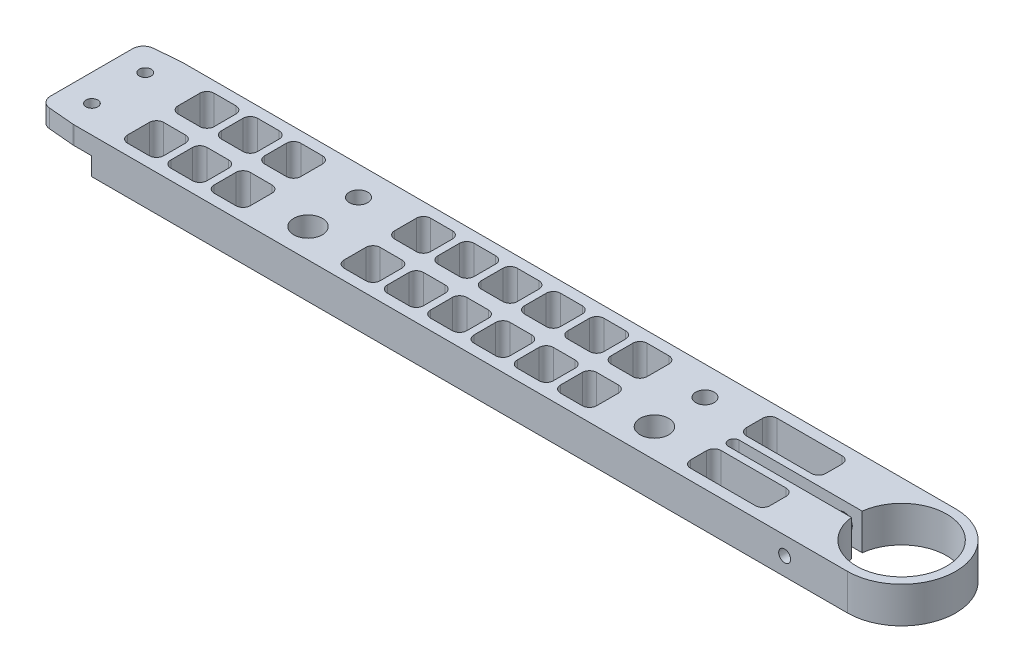
from build123d import *

# Parameters (mm, degrees)
EXTRUDE_1_DEPTH             = 10
SKETCH_4_W                  = 15
SKETCH_4_H                  = 30
CUT_EXTRUDE_2_DEPTH         = 5
FILLET_1_R                  = 3
CUT_EXTRUDE_3_DEPTH         = 243.074368738
SKETCH_6_W                  = 23.844659042
SKETCH_6_H                  = 25.610930083
SKETCH_6_W_2                = 24.286226803
EXTRUDE_2_DEPTH             = 10
HOLE_WIZARD_1_4_201_D       = 5.1054
HOLE_WIZARD_3_8_161_D       = 7.9375
SKETCH_12_R                 = 12.5
CUT_EXTRUDE_4_DEPTH         = 243.074368738
SKETCH_13_W                 = 12.089662748
SKETCH_13_H                 = 26.414389197
EXTRUDE_3_DEPTH             = 10
CUT_EXTRUDE_5_DEPTH         = 10
SKETCH_16_W                 = 1.65
SKETCH_16_H                 = 13.5
HOLE_WIZARD_M41_D           = 4.5
HOLE_WIZARD_M41_DEPTH       = 13.5
HOLE_WIZARD_M41_CBORE_D     = 8
HOLE_WIZARD_M41_CBORE_DEPTH = 4
M4X0_73_D                   = 3.3
EXTRUDE_5_DEPTH             = 10
CUT_EXTRUDE_6_DEPTH         = 242.578662137


with BuildPart() as part:
    # Эскиз1 → Бобышка-Вытянуть1 (new body)
    with BuildSketch(Plane(origin=(0, 0, 0), x_dir=(1, 0, 0), z_dir=(0, 1, 0))):
        Polygon((15, 0), (240, 0), (240, 30), (15, 30), (10, 30), (0, 29.125113365), (0, 0.874886635), (10, 0), align=None)
    extrude(amount=EXTRUDE_1_DEPTH)

    # Эскиз4 → Вырез-Вытянуть2 (cut)
    with BuildSketch(Plane.XZ):
        with Locations((7.5, -15)):
            Rectangle(SKETCH_4_W, SKETCH_4_H)
    extrude(amount=-CUT_EXTRUDE_2_DEPTH, mode=Mode.SUBTRACT)

    # Скругление1
    # the kernel refuses this fillet: 3 mm, written as the material it takes off along each edge
    with BuildSketch(Plane(origin=(10, 4.672542928, 0), x_dir=(1, 0, 0), z_dir=(0, 1, 0))) as fillet_1_piece_1:
        with BuildLine():
            CenterArc((FILLET_1_R * 0.0436609429085, FILLET_1_R), FILLET_1_R, 265, 5)
            Line((-FILLET_1_R * 0.0434947998391, FILLET_1_R * 0.00380530190825), (0, 0))
            Line((0, 0), (FILLET_1_R * 0.0436609429085, 0))
        make_face()
    extrude(amount=5.654914144, mode=Mode.SUBTRACT)
    with BuildSketch(Plane(origin=(0, -1.872483805, -0.874886635), x_dir=(0.9961946980917453, 0, 0.08715574274766123), z_dir=(0, 1, 0))) as fillet_1_piece_2:
        with BuildLine():
            CenterArc((FILLET_1_R * 0.916331174017, FILLET_1_R), FILLET_1_R, 185, 85)
            Line((-FILLET_1_R * 0.0798635240743, FILLET_1_R * 0.912844257252), (0, 0))
            Line((0, 0), (FILLET_1_R * 0.916331174017, 0))
        make_face()
    extrude(amount=18.74496761, mode=Mode.SUBTRACT)
    with BuildSketch(Plane(origin=(0, -1.872483805, -29.125113365), x_dir=(0.9961946980917452, 0, -0.08715574274766204), z_dir=(0, 1, 0))) as fillet_1_piece_3:
        with BuildLine():
            CenterArc((FILLET_1_R * 0.916331174017, -FILLET_1_R), FILLET_1_R, 90, 85)
            Line((-FILLET_1_R * 0.0798635240743, -FILLET_1_R * 0.912844257252), (0, 0))
            Line((0, 0), (FILLET_1_R * 0.916331174017, 0))
        make_face()
    extrude(amount=18.74496761, mode=Mode.SUBTRACT)
    with BuildSketch(Plane(origin=(10, 4.672542928, -30), x_dir=(1, 0, 0), z_dir=(0, 1, 0))) as fillet_1_piece_4:
        with BuildLine():
            CenterArc((FILLET_1_R * 0.0436609429085, -FILLET_1_R), FILLET_1_R, 90, 5)
            Line((-FILLET_1_R * 0.0434947998391, -FILLET_1_R * 0.00380530190825), (0, 0))
            Line((0, 0), (FILLET_1_R * 0.0436609429085, 0))
        make_face()
    extrude(amount=5.654914144, mode=Mode.SUBTRACT)

    # Эскиз5 → Вырез-Вытянуть3 (cut, through all)
    with BuildSketch(Plane.XZ):
        with BuildLine():
            Line((22, -17), (28, -17))
            ThreePointArc((28, -17), (29.414213562, -17.585786438), (30, -19))
            Line((30, -19), (30, -25))
            ThreePointArc((30, -25), (29.414213562, -26.414213562), (28, -27))
            Line((28, -27), (22, -27))
            ThreePointArc((22, -27), (20.585786438, -26.414213562), (20, -25))
            Line((20, -25), (20, -19))
            ThreePointArc((20, -19), (20.585786438, -17.585786438), (22, -17))
        make_face()
        with BuildLine():
            Line((34, -17), (40, -17))
            ThreePointArc((40, -17), (41.414213562, -17.585786438), (42, -19))
            Line((42, -19), (42, -25))
            ThreePointArc((42, -25), (41.414213562, -26.414213562), (40, -27))
            Line((40, -27), (34, -27))
            ThreePointArc((34, -27), (32.585786438, -26.414213562), (32, -25))
            Line((32, -25), (32, -19))
            ThreePointArc((32, -19), (32.585786438, -17.585786438), (34, -17))
        make_face()
        with BuildLine():
            Line((46, -17), (52, -17))
            ThreePointArc((52, -17), (53.414213562, -17.585786438), (54, -19))
            Line((54, -19), (54, -25))
            ThreePointArc((54, -25), (53.414213562, -26.414213562), (52, -27))
            Line((52, -27), (46, -27))
            ThreePointArc((46, -27), (44.585786438, -26.414213562), (44, -25))
            Line((44, -25), (44, -19))
            ThreePointArc((44, -19), (44.585786438, -17.585786438), (46, -17))
        make_face()
        with BuildLine():
            Line((58, -17), (64, -17))
            ThreePointArc((64, -17), (65.414213562, -17.585786438), (66, -19))
            Line((66, -19), (66, -25))
            ThreePointArc((66, -25), (65.414213562, -26.414213562), (64, -27))
            Line((64, -27), (58, -27))
            ThreePointArc((58, -27), (56.585786438, -26.414213562), (56, -25))
            Line((56, -25), (56, -19))
            ThreePointArc((56, -19), (56.585786438, -17.585786438), (58, -17))
        make_face()
        with BuildLine():
            Line((70, -17), (76, -17))
            ThreePointArc((76, -17), (77.414213562, -17.585786438), (78, -19))
            Line((78, -19), (78, -25))
            ThreePointArc((78, -25), (77.414213562, -26.414213562), (76, -27))
            Line((76, -27), (70, -27))
            ThreePointArc((70, -27), (68.585786438, -26.414213562), (68, -25))
            Line((68, -25), (68, -19))
            ThreePointArc((68, -19), (68.585786438, -17.585786438), (70, -17))
        make_face()
        with BuildLine():
            Line((82, -17), (88, -17))
            ThreePointArc((88, -17), (89.414213562, -17.585786438), (90, -19))
            Line((90, -19), (90, -25))
            ThreePointArc((90, -25), (89.414213562, -26.414213562), (88, -27))
            Line((88, -27), (82, -27))
            ThreePointArc((82, -27), (80.585786438, -26.414213562), (80, -25))
            Line((80, -25), (80, -19))
            ThreePointArc((80, -19), (80.585786438, -17.585786438), (82, -17))
        make_face()
        with BuildLine():
            Line((94, -17), (100, -17))
            ThreePointArc((100, -17), (101.414213562, -17.585786438), (102, -19))
            Line((102, -19), (102, -25))
            ThreePointArc((102, -25), (101.414213562, -26.414213562), (100, -27))
            Line((100, -27), (94, -27))
            ThreePointArc((94, -27), (92.585786438, -26.414213562), (92, -25))
            Line((92, -25), (92, -19))
            ThreePointArc((92, -19), (92.585786438, -17.585786438), (94, -17))
        make_face()
        with BuildLine():
            Line((106, -17), (112, -17))
            ThreePointArc((112, -17), (113.414213562, -17.585786438), (114, -19))
            Line((114, -19), (114, -25))
            ThreePointArc((114, -25), (113.414213562, -26.414213562), (112, -27))
            Line((112, -27), (106, -27))
            ThreePointArc((106, -27), (104.585786438, -26.414213562), (104, -25))
            Line((104, -25), (104, -19))
            ThreePointArc((104, -19), (104.585786438, -17.585786438), (106, -17))
        make_face()
        with BuildLine():
            Line((118, -17), (124, -17))
            ThreePointArc((124, -17), (125.414213562, -17.585786438), (126, -19))
            Line((126, -19), (126, -25))
            ThreePointArc((126, -25), (125.414213562, -26.414213562), (124, -27))
            Line((124, -27), (118, -27))
            ThreePointArc((118, -27), (116.585786438, -26.414213562), (116, -25))
            Line((116, -25), (116, -19))
            ThreePointArc((116, -19), (116.585786438, -17.585786438), (118, -17))
        make_face()
        with BuildLine():
            Line((130, -17), (136, -17))
            ThreePointArc((136, -17), (137.414213562, -17.585786438), (138, -19))
            Line((138, -19), (138, -25))
            ThreePointArc((138, -25), (137.414213562, -26.414213562), (136, -27))
            Line((136, -27), (130, -27))
            ThreePointArc((130, -27), (128.585786438, -26.414213562), (128, -25))
            Line((128, -25), (128, -19))
            ThreePointArc((128, -19), (128.585786438, -17.585786438), (130, -17))
        make_face()
        with BuildLine():
            Line((142, -17), (148, -17))
            ThreePointArc((148, -17), (149.414213562, -17.585786438), (150, -19))
            Line((150, -19), (150, -25))
            ThreePointArc((150, -25), (149.414213562, -26.414213562), (148, -27))
            Line((148, -27), (142, -27))
            ThreePointArc((142, -27), (140.585786438, -26.414213562), (140, -25))
            Line((140, -25), (140, -19))
            ThreePointArc((140, -19), (140.585786438, -17.585786438), (142, -17))
        make_face()
        with BuildLine():
            Line((154, -17), (160, -17))
            ThreePointArc((160, -17), (161.414213562, -17.585786438), (162, -19))
            Line((162, -19), (162, -25))
            ThreePointArc((162, -25), (161.414213562, -26.414213562), (160, -27))
            Line((160, -27), (154, -27))
            ThreePointArc((154, -27), (152.585786438, -26.414213562), (152, -25))
            Line((152, -25), (152, -19))
            ThreePointArc((152, -19), (152.585786438, -17.585786438), (154, -17))
        make_face()
        with BuildLine():
            Line((166, -17), (172, -17))
            ThreePointArc((172, -17), (173.414213562, -17.585786438), (174, -19))
            Line((174, -19), (174, -25))
            ThreePointArc((174, -25), (173.414213562, -26.414213562), (172, -27))
            Line((172, -27), (166, -27))
            ThreePointArc((166, -27), (164.585786438, -26.414213562), (164, -25))
            Line((164, -25), (164, -19))
            ThreePointArc((164, -19), (164.585786438, -17.585786438), (166, -17))
        make_face()
        with BuildLine():
            Line((178, -17), (184, -17))
            ThreePointArc((184, -17), (185.414213562, -17.585786438), (186, -19))
            Line((186, -19), (186, -25))
            ThreePointArc((186, -25), (185.414213562, -26.414213562), (184, -27))
            Line((184, -27), (178, -27))
            ThreePointArc((178, -27), (176.585786438, -26.414213562), (176, -25))
            Line((176, -25), (176, -19))
            ThreePointArc((176, -19), (176.585786438, -17.585786438), (178, -17))
        make_face()
        with BuildLine():
            Line((190, -17), (196, -17))
            ThreePointArc((196, -17), (197.414213562, -17.585786438), (198, -19))
            Line((198, -19), (198, -25))
            ThreePointArc((198, -25), (197.414213562, -26.414213562), (196, -27))
            Line((196, -27), (190, -27))
            ThreePointArc((190, -27), (188.585786438, -26.414213562), (188, -25))
            Line((188, -25), (188, -19))
            ThreePointArc((188, -19), (188.585786438, -17.585786438), (190, -17))
        make_face()
        with BuildLine():
            Line((202, -17), (208, -17))
            ThreePointArc((208, -17), (209.414213562, -17.585786438), (210, -19))
            Line((210, -19), (210, -25))
            ThreePointArc((210, -25), (209.414213562, -26.414213562), (208, -27))
            Line((208, -27), (202, -27))
            ThreePointArc((202, -27), (200.585786438, -26.414213562), (200, -25))
            Line((200, -25), (200, -19))
            ThreePointArc((200, -19), (200.585786438, -17.585786438), (202, -17))
        make_face()
        with BuildLine():
            Line((210, -11), (210, -5))
            ThreePointArc((210, -5), (209.414213562, -3.585786438), (208, -3))
            Line((208, -3), (202, -3))
            ThreePointArc((202, -3), (200.585786438, -3.585786438), (200, -5))
            Line((200, -5), (200, -11))
            ThreePointArc((200, -11), (200.585786438, -12.414213562), (202, -13))
            Line((202, -13), (208, -13))
            ThreePointArc((208, -13), (209.414213562, -12.414213562), (210, -11))
        make_face()
        with BuildLine():
            Line((198, -11), (198, -5))
            ThreePointArc((198, -5), (197.414213562, -3.585786438), (196, -3))
            Line((196, -3), (190, -3))
            ThreePointArc((190, -3), (188.585786438, -3.585786438), (188, -5))
            Line((188, -5), (188, -11))
            ThreePointArc((188, -11), (188.585786438, -12.414213562), (190, -13))
            Line((190, -13), (196, -13))
            ThreePointArc((196, -13), (197.414213562, -12.414213562), (198, -11))
        make_face()
        with BuildLine():
            Line((186, -11), (186, -5))
            ThreePointArc((186, -5), (185.414213562, -3.585786438), (184, -3))
            Line((184, -3), (178, -3))
            ThreePointArc((178, -3), (176.585786438, -3.585786438), (176, -5))
            Line((176, -5), (176, -11))
            ThreePointArc((176, -11), (176.585786438, -12.414213562), (178, -13))
            Line((178, -13), (184, -13))
            ThreePointArc((184, -13), (185.414213562, -12.414213562), (186, -11))
        make_face()
        with BuildLine():
            Line((174, -11), (174, -5))
            ThreePointArc((174, -5), (173.414213562, -3.585786438), (172, -3))
            Line((172, -3), (166, -3))
            ThreePointArc((166, -3), (164.585786438, -3.585786438), (164, -5))
            Line((164, -5), (164, -11))
            ThreePointArc((164, -11), (164.585786438, -12.414213562), (166, -13))
            Line((166, -13), (172, -13))
            ThreePointArc((172, -13), (173.414213562, -12.414213562), (174, -11))
        make_face()
        with BuildLine():
            Line((162, -11), (162, -5))
            ThreePointArc((162, -5), (161.414213562, -3.585786438), (160, -3))
            Line((160, -3), (154, -3))
            ThreePointArc((154, -3), (152.585786438, -3.585786438), (152, -5))
            Line((152, -5), (152, -11))
            ThreePointArc((152, -11), (152.585786438, -12.414213562), (154, -13))
            Line((154, -13), (160, -13))
            ThreePointArc((160, -13), (161.414213562, -12.414213562), (162, -11))
        make_face()
        with BuildLine():
            Line((150, -11), (150, -5))
            ThreePointArc((150, -5), (149.414213562, -3.585786438), (148, -3))
            Line((148, -3), (142, -3))
            ThreePointArc((142, -3), (140.585786438, -3.585786438), (140, -5))
            Line((140, -5), (140, -11))
            ThreePointArc((140, -11), (140.585786438, -12.414213562), (142, -13))
            Line((142, -13), (148, -13))
            ThreePointArc((148, -13), (149.414213562, -12.414213562), (150, -11))
        make_face()
        with BuildLine():
            Line((138, -11), (138, -5))
            ThreePointArc((138, -5), (137.414213562, -3.585786438), (136, -3))
            Line((136, -3), (130, -3))
            ThreePointArc((130, -3), (128.585786438, -3.585786438), (128, -5))
            Line((128, -5), (128, -11))
            ThreePointArc((128, -11), (128.585786438, -12.414213562), (130, -13))
            Line((130, -13), (136, -13))
            ThreePointArc((136, -13), (137.414213562, -12.414213562), (138, -11))
        make_face()
        with BuildLine():
            Line((126, -11), (126, -5))
            ThreePointArc((126, -5), (125.414213562, -3.585786438), (124, -3))
            Line((124, -3), (118, -3))
            ThreePointArc((118, -3), (116.585786438, -3.585786438), (116, -5))
            Line((116, -5), (116, -11))
            ThreePointArc((116, -11), (116.585786438, -12.414213562), (118, -13))
            Line((118, -13), (124, -13))
            ThreePointArc((124, -13), (125.414213562, -12.414213562), (126, -11))
        make_face()
        with BuildLine():
            Line((114, -11), (114, -5))
            ThreePointArc((114, -5), (113.414213562, -3.585786438), (112, -3))
            Line((112, -3), (106, -3))
            ThreePointArc((106, -3), (104.585786438, -3.585786438), (104, -5))
            Line((104, -5), (104, -11))
            ThreePointArc((104, -11), (104.585786438, -12.414213562), (106, -13))
            Line((106, -13), (112, -13))
            ThreePointArc((112, -13), (113.414213562, -12.414213562), (114, -11))
        make_face()
        with BuildLine():
            Line((102, -11), (102, -5))
            ThreePointArc((102, -5), (101.414213562, -3.585786438), (100, -3))
            Line((100, -3), (94, -3))
            ThreePointArc((94, -3), (92.585786438, -3.585786438), (92, -5))
            Line((92, -5), (92, -11))
            ThreePointArc((92, -11), (92.585786438, -12.414213562), (94, -13))
            Line((94, -13), (100, -13))
            ThreePointArc((100, -13), (101.414213562, -12.414213562), (102, -11))
        make_face()
        with BuildLine():
            Line((90, -11), (90, -5))
            ThreePointArc((90, -5), (89.414213562, -3.585786438), (88, -3))
            Line((88, -3), (82, -3))
            ThreePointArc((82, -3), (80.585786438, -3.585786438), (80, -5))
            Line((80, -5), (80, -11))
            ThreePointArc((80, -11), (80.585786438, -12.414213562), (82, -13))
            Line((82, -13), (88, -13))
            ThreePointArc((88, -13), (89.414213562, -12.414213562), (90, -11))
        make_face()
        with BuildLine():
            Line((78, -11), (78, -5))
            ThreePointArc((78, -5), (77.414213562, -3.585786438), (76, -3))
            Line((76, -3), (70, -3))
            ThreePointArc((70, -3), (68.585786438, -3.585786438), (68, -5))
            Line((68, -5), (68, -11))
            ThreePointArc((68, -11), (68.585786438, -12.414213562), (70, -13))
            Line((70, -13), (76, -13))
            ThreePointArc((76, -13), (77.414213562, -12.414213562), (78, -11))
        make_face()
        with BuildLine():
            Line((66, -11), (66, -5))
            ThreePointArc((66, -5), (65.414213562, -3.585786438), (64, -3))
            Line((64, -3), (58, -3))
            ThreePointArc((58, -3), (56.585786438, -3.585786438), (56, -5))
            Line((56, -5), (56, -11))
            ThreePointArc((56, -11), (56.585786438, -12.414213562), (58, -13))
            Line((58, -13), (64, -13))
            ThreePointArc((64, -13), (65.414213562, -12.414213562), (66, -11))
        make_face()
        with BuildLine():
            Line((54, -11), (54, -5))
            ThreePointArc((54, -5), (53.414213562, -3.585786438), (52, -3))
            Line((52, -3), (46, -3))
            ThreePointArc((46, -3), (44.585786438, -3.585786438), (44, -5))
            Line((44, -5), (44, -11))
            ThreePointArc((44, -11), (44.585786438, -12.414213562), (46, -13))
            Line((46, -13), (52, -13))
            ThreePointArc((52, -13), (53.414213562, -12.414213562), (54, -11))
        make_face()
        with BuildLine():
            Line((42, -11), (42, -5))
            ThreePointArc((42, -5), (41.414213562, -3.585786438), (40, -3))
            Line((40, -3), (34, -3))
            ThreePointArc((34, -3), (32.585786438, -3.585786438), (32, -5))
            Line((32, -5), (32, -11))
            ThreePointArc((32, -11), (32.585786438, -12.414213562), (34, -13))
            Line((34, -13), (40, -13))
            ThreePointArc((40, -13), (41.414213562, -12.414213562), (42, -11))
        make_face()
        with BuildLine():
            Line((30, -11), (30, -5))
            ThreePointArc((30, -5), (29.414213562, -3.585786438), (28, -3))
            Line((28, -3), (22, -3))
            ThreePointArc((22, -3), (20.585786438, -3.585786438), (20, -5))
            Line((20, -5), (20, -11))
            ThreePointArc((20, -11), (20.585786438, -12.414213562), (22, -13))
            Line((22, -13), (28, -13))
            ThreePointArc((28, -13), (29.414213562, -12.414213562), (30, -11))
        make_face()
    extrude(amount=-CUT_EXTRUDE_3_DEPTH, mode=Mode.SUBTRACT)

    # Эскиз6 → Бобышка-Вытянуть2 (add, through all)
    with BuildSketch(Plane.XZ):
        with Locations((66.835729878, -14.983546906)):
            Rectangle(SKETCH_6_W, SKETCH_6_H)
        with Locations((163.057950753, -14.983546906)):
            Rectangle(SKETCH_6_W_2, SKETCH_6_H)
    extrude(amount=-EXTRUDE_2_DEPTH)

    # Отверстие обработанное метчиком 1/4-201 (through all)
    with Locations(Plane(origin=(0, 0, 0), x_dir=(-1, 0, 0), z_dir=(0, -1, 0))):
        with Locations((-67, 22), (-163, 22)):
            Hole(HOLE_WIZARD_1_4_201_D / 2)

    # Отверстие обработанное метчиком 3/8-161 (through all)
    with Locations(Plane(origin=(0, 0, 0), x_dir=(-1, 0, 0), z_dir=(0, -1, 0))):
        with Locations((-163, 8), (-67, 8)):
            Hole(HOLE_WIZARD_3_8_161_D / 2)

    # Эскиз12 → Вырез-Вытянуть4 (cut, through all)
    with BuildSketch(Plane.XZ):
        with Locations(Location((224.5, -15, 0), (0, 0, 270))):
            Circle(SKETCH_12_R)
        with BuildLine():
            Line((224.5, -30), (240, -30))
            Line((240, -30), (240, 0))
            Line((240, 0), (224.5, 0))
            ThreePointArc((224.5, 0), (239.5, -15), (224.5, -30))
        make_face()
    extrude(amount=-CUT_EXTRUDE_4_DEPTH, mode=Mode.SUBTRACT)

    # Эскиз13 → Бобышка-Вытянуть3 (add, through all)
    with BuildSketch(Plane.XZ):
        with Locations((204.936183739, -15.076136097)):
            Rectangle(SKETCH_13_W, SKETCH_13_H)
    extrude(amount=-EXTRUDE_3_DEPTH)

    # Эскиз14 → Вырез-Вытянуть5 (cut)
    with BuildSketch(Plane.XZ):
        with BuildLine():
            Line((178, -13.5), (213.598015613, -13.5))
            ThreePointArc((213.598015613, -13.5), (215.098015613, -15), (213.598015613, -16.5))
            Line((213.598015613, -16.5), (178, -16.5))
            ThreePointArc((178, -16.5), (176.5, -15), (178, -13.5))
        make_face()
    extrude(amount=-CUT_EXTRUDE_5_DEPTH, mode=Mode.SUBTRACT)

    # Эскиз16 → Отверстие обработанное метчиком M4x0.71 (revolve, cut)
    with BuildSketch(Plane(origin=(207.090326354, 5, -13.5), x_dir=(0, 1, 0), z_dir=(1, 0, 0))):
        with Locations((0.825, 6.75)):
            Rectangle(SKETCH_16_W, SKETCH_16_H)
    revolve(axis=Axis((207.090326354, 5, -19.85), (0, 0, 1)), mode=Mode.SUBTRACT)

    # Цековка для винта с внутренним шестигранником M41
    with Locations(Plane(origin=(0, 0, -30), x_dir=(-1, 0, 0), z_dir=(0, 0, -1))):
        with Locations((-207.090326354, 5)):
            CounterBoreHole(HOLE_WIZARD_M41_D / 2, HOLE_WIZARD_M41_CBORE_D / 2, HOLE_WIZARD_M41_CBORE_DEPTH, depth=HOLE_WIZARD_M41_DEPTH)

    # Отверстие обработанное метчиком M4x0.73 (through all)
    with Locations(Plane(origin=(0, 5, 0), x_dir=(-1, 0, 0), z_dir=(0, -1, 0))):
        with Locations((-7.5, 7.609360829), (-7.5, 22.390639171)):
            Hole(M4X0_73_D / 2)

    # Эскиз23 → Бобышка-Вытянуть5 (add, through all)
    with BuildSketch(Plane.XZ):
        with BuildLine():
            Line((178, -11.5), (184, -11.5))
            ThreePointArc((184, -11.5), (185.414213562, -10.914213562), (186, -9.5))
            Line((186, -9.5), (186, -11))
            ThreePointArc((186, -11), (185.414213562, -12.414213562), (184, -13))
            Line((184, -13), (178, -13))
            ThreePointArc((178, -13), (176.585786438, -12.414213562), (176, -11))
            Line((176, -11), (176, -9.5))
            ThreePointArc((176, -9.5), (176.585786438, -10.914213562), (178, -11.5))
        make_face()
        with BuildLine():
            Line((178, -18.5), (184, -18.5))
            ThreePointArc((184, -18.5), (185.414213562, -19.085786438), (186, -20.5))
            Line((186, -20.5), (186, -19))
            ThreePointArc((186, -19), (185.414213562, -17.585786438), (184, -17))
            Line((184, -17), (178, -17))
            ThreePointArc((178, -17), (176.585786438, -17.585786438), (176, -19))
            Line((176, -19), (176, -20.5))
            ThreePointArc((176, -20.5), (176.585786438, -19.085786438), (178, -18.5))
        make_face()
        with BuildLine():
            Line((196, -11.5), (190, -11.5))
            ThreePointArc((190, -11.5), (188.585786438, -10.914213562), (188, -9.5))
            Line((188, -9.5), (188, -11))
            ThreePointArc((188, -11), (188.585786438, -12.414213562), (190, -13))
            Line((190, -13), (196, -13))
            ThreePointArc((196, -13), (197.414213562, -12.414213562), (198, -11))
            Line((198, -11), (198, -9.5))
            ThreePointArc((198, -9.5), (197.414213562, -10.914213562), (196, -11.5))
        make_face()
        with BuildLine():
            Line((198, -20.5), (198, -19))
            ThreePointArc((198, -19), (197.414213562, -17.585786438), (196, -17))
            Line((196, -17), (190, -17))
            ThreePointArc((190, -17), (188.585786438, -17.585786438), (188, -19))
            Line((188, -19), (188, -20.5))
            ThreePointArc((188, -20.5), (188.585786438, -19.085786438), (190, -18.5))
            Line((190, -18.5), (196, -18.5))
            ThreePointArc((196, -18.5), (197.414213562, -19.085786438), (198, -20.5))
        make_face()
    extrude(amount=-EXTRUDE_5_DEPTH)

    # Эскиз26 → Вырез-Вытянуть6 (cut, through all)
    with BuildSketch(Plane.XZ):
        with BuildLine():
            Line((178, -11.5), (190, -11.5))
            Line((190, -11.5), (196, -11.5))
            ThreePointArc((196, -11.5), (197.414213562, -10.914213562), (198, -9.5))
            Line((198, -9.5), (198, -5))
            ThreePointArc((198, -5), (197.414213562, -3.585786438), (196, -3))
            Line((196, -3), (190, -3))
            Line((190, -3), (178, -3))
            ThreePointArc((178, -3), (176.585786438, -3.585786438), (176, -5))
            Line((176, -5), (176, -9.5))
            ThreePointArc((176, -9.5), (176.585786438, -10.914213562), (178, -11.5))
        make_face()
        with BuildLine():
            Line((176, -20.5), (176, -25))
            ThreePointArc((176, -25), (176.585786438, -26.414213562), (178, -27))
            Line((178, -27), (190, -27))
            Line((190, -27), (196, -27))
            ThreePointArc((196, -27), (197.414213562, -26.414213562), (198, -25))
            Line((198, -25), (198, -20.5))
            ThreePointArc((198, -20.5), (197.414213562, -19.085786438), (196, -18.5))
            Line((196, -18.5), (190, -18.5))
            Line((190, -18.5), (178, -18.5))
            ThreePointArc((178, -18.5), (176.585786438, -19.085786438), (176, -20.5))
        make_face()
    extrude(amount=-CUT_EXTRUDE_6_DEPTH, mode=Mode.SUBTRACT)


solid = part.part
